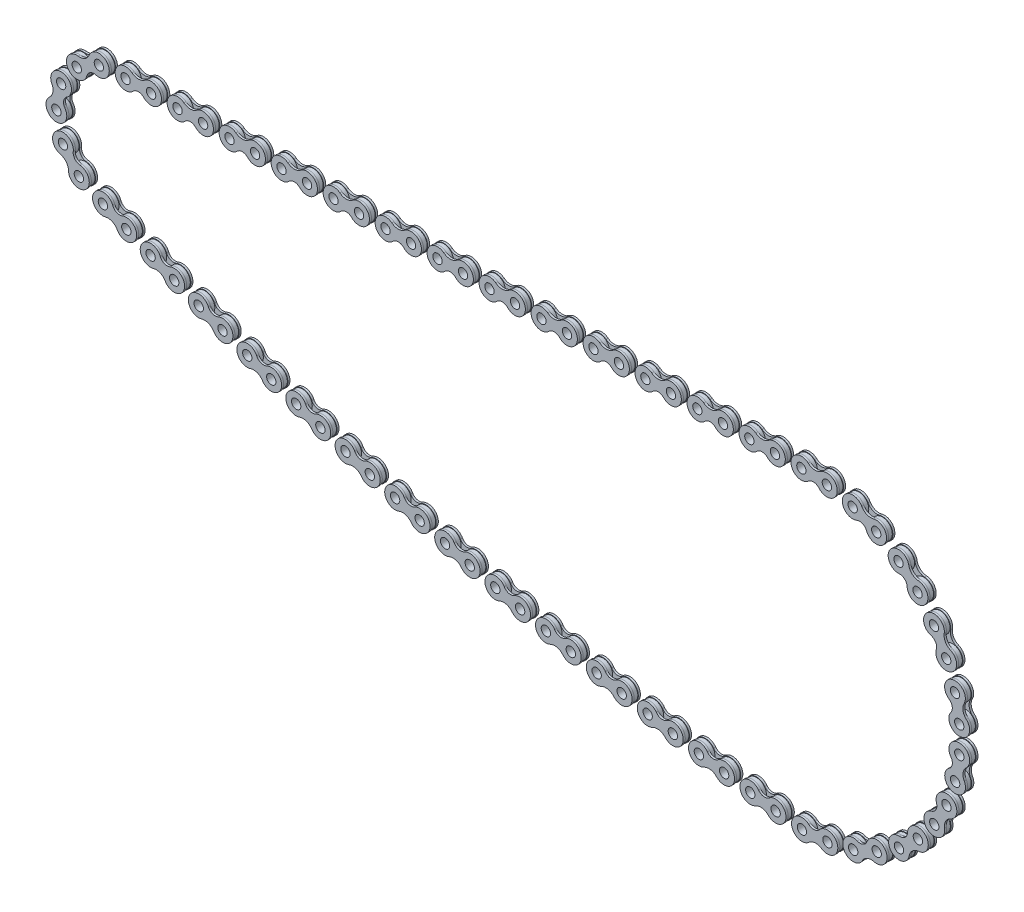
from build123d import *

# Parameters (mm, degrees)
SKETCH1_R             = 4.75
SKETCH1_R_2           = 2.25
BOSS_EXTRUDE1_DEPTH   = 1
BOSS_EXTRUDE1_2_DEPTH = 1
BOSS_EXTRUDE2_DEPTH   = 1
SKETCH4_R             = 2.25
CUT_EXTRUDE1_DEPTH    = 13.382346304
SKETCH5_R             = 2.25
CUT_EXTRUDE2_DEPTH    = 13.582626912
CRVPATTERN1_5_ANGLE   = 3.8901012
CRVPATTERN1_6_ANGLE   = 23.0027709
CRVPATTERN1_7_ANGLE   = 42.1154406
CRVPATTERN1_8_ANGLE   = 61.2281103
CRVPATTERN1_9_ANGLE   = 80.34078
CRVPATTERN1_10_ANGLE  = 99.4534497
CRVPATTERN1_11_ANGLE  = 118.5661194
CRVPATTERN1_12_ANGLE  = 137.6787891
CRVPATTERN1_13_ANGLE  = 156.7914588
CRVPATTERN1_14_ANGLE  = 175.9041285
CRVPATTERN1_15_ANGLE  = 172.3357403
CRVPATTERN1_16_ANGLE  = 171.095109
CRVPATTERN1_17_ANGLE  = 169.8544777
CRVPATTERN1_18_ANGLE  = 168.6138464
CRVPATTERN1_19_ANGLE  = 167.3732151
CRVPATTERN1_20_ANGLE  = 166.1325838
CRVPATTERN1_21_ANGLE  = 164.8919525
CRVPATTERN1_22_ANGLE  = 163.6513212
CRVPATTERN1_23_ANGLE  = 162.4106898
CRVPATTERN1_24_ANGLE  = 161.1700585
CRVPATTERN1_25_ANGLE  = 159.9294272
CRVPATTERN1_26_ANGLE  = 158.6887959
CRVPATTERN1_27_ANGLE  = 157.4481646
CRVPATTERN1_28_ANGLE  = 156.2075333
CRVPATTERN1_29_ANGLE  = 128.6116148
CRVPATTERN1_30_ANGLE  = 79.3521569
CRVPATTERN1_31_ANGLE  = 30.0926989


with BuildPart() as part:
    # Sketch1 → Boss-Extrude1 (new, symmetric)
    with BuildSketch(Plane.XY):
        with Locations((-6.15, 0)):
            Circle(SKETCH1_R)
        with Locations((-6.15, 0)):
            Circle(SKETCH1_R_2, mode=Mode.SUBTRACT)
    extrude(amount=BOSS_EXTRUDE1_DEPTH, both=True)



with BuildPart() as body_2:
    # Sketch1 → Boss-Extrude1 2 (new, symmetric)
    with BuildSketch(Plane.XY):
        with Locations(Location((6.15, 0, 0), (0, 0, 180))):
            Circle(SKETCH1_R)
        with Locations((6.15, 0)):
            Circle(SKETCH1_R_2, mode=Mode.SUBTRACT)
    extrude(amount=BOSS_EXTRUDE1_2_DEPTH, both=True)


with BuildPart() as part_1:
    add(part.part)

    add(body_2.part)  # Boss-Extrude2 merges body 2
    # Sketch2 → Boss-Extrude2 (add)
    with BuildSketch(Plane.XY.offset(1)):
        with BuildLine():
            ThreePointArc((-3.073778952, 3.941682897), (-11.138276168, -0.342200045), (-2.564324669, -3.484671063))
            ThreePointArc((-2.564324669, -3.484671063), (0, -2.400971337), (2.564324669, -3.484671063))
            ThreePointArc((2.564324669, -3.484671063), (11.138276168, -0.342200045), (3.073778952, 3.941682897))
            ThreePointArc((3.073778952, 3.941682897), (0, 2.884205953), (-3.073778952, 3.941682897))
        make_face()
    boss_extrude2 = extrude(amount=BOSS_EXTRUDE2_DEPTH)

    # Sketch4 → Cut-Extrude1 (cut, through all)
    with BuildSketch(Plane(origin=(0, 0, 1), x_dir=(-1, 0, 0), z_dir=(0, 0, -1))):
        with Locations((-6.15, 0)):
            Circle(SKETCH4_R)
        with Locations((6.15, 0)):
            Circle(SKETCH4_R)
    extrude(amount=-CUT_EXTRUDE1_DEPTH, mode=Mode.SUBTRACT)

    # Mirror1: Boss-Extrude2 across plane
    add(boss_extrude2.mirror(Plane.XY))

    # Sketch5 → Cut-Extrude2 (cut, through all)
    with BuildSketch(Plane.XY.offset(-1)):
        with Locations(Location((6.15, 0, 0), (0, 0, 180))):
            Circle(SKETCH5_R)
        with Locations(Location((-6.15, 0, 0), (0, 0, 180))):
            Circle(SKETCH5_R)
    extrude(amount=-CUT_EXTRUDE2_DEPTH, mode=Mode.SUBTRACT)


with BuildPart() as body_2_2:
    # CrvPattern1: read off the stored shape, not the designer's step
    # CrvPattern1: copy of part
    add(part_1.part.moved(Location((25.0184261, 0, 0))))


with BuildPart() as body_3:
    # CrvPattern1 2: copy of part
    add(part_1.part.moved(Location((50.0368522, 0, 0))))


with BuildPart() as body_4:
    # CrvPattern1 3: copy of part
    add(part_1.part.moved(Location((75.0552784, 0, 0))))


with BuildPart() as body_5:
    # CrvPattern1 4: copy of part
    add(part_1.part.moved(Location((100.0737045, 0, 0))))


with BuildPart() as body_6:
    # CrvPattern1 5: copy of part
    add(part_1.part.moved(Location((124.8094416, 8.3138717, 0))).rotate(Axis((0, 0, 0), (0, 0, -1)), CRVPATTERN1_5_ANGLE))


with BuildPart() as body_7:
    # CrvPattern1 6: copy of part
    add(part_1.part.moved(Location((139.7532434, 52.8539358, 0))).rotate(Axis((0, 0, 0), (0, 0, -1)), CRVPATTERN1_6_ANGLE))


with BuildPart() as body_8:
    # CrvPattern1 7: copy of part
    add(part_1.part.moved(Location((139.2896784, 99.831799, 0))).rotate(Axis((0, 0, 0), (0, 0, -1)), CRVPATTERN1_7_ANGLE))


with BuildPart() as body_9:
    # CrvPattern1 8: copy of part
    add(part_1.part.moved(Location((123.4698531, 144.0682958, 0))).rotate(Axis((0, 0, 0), (0, 0, -1)), CRVPATTERN1_8_ANGLE))


with BuildPart() as body_10:
    # CrvPattern1 9: copy of part
    add(part_1.part.moved(Location((94.0378548, 180.686488, 0))).rotate(Axis((0, 0, 0), (0, 0, -1)), CRVPATTERN1_9_ANGLE))


with BuildPart() as body_11:
    # CrvPattern1 10: copy of part
    add(part_1.part.moved(Location((54.2384712, 205.6493321, 0))).rotate(Axis((0, 0, 0), (0, 0, -1)), CRVPATTERN1_10_ANGLE))


with BuildPart() as body_12:
    # CrvPattern1 11: copy of part
    add(part_1.part.moved(Location((8.4594623, 216.204751, 0))).rotate(Axis((0, 0, 0), (0, 0, -1)), CRVPATTERN1_11_ANGLE))


with BuildPart() as body_13:
    # CrvPattern1 12: copy of part
    add(part_1.part.moved(Location((-38.2521764, 211.1890422, 0))).rotate(Axis((0, 0, 0), (0, 0, -1)), CRVPATTERN1_12_ANGLE))


with BuildPart() as body_14:
    # CrvPattern1 13: copy of part
    add(part_1.part.moved(Location((-80.7466298, 191.1551721, 0))).rotate(Axis((0, 0, 0), (0, 0, -1)), CRVPATTERN1_13_ANGLE))


with BuildPart() as body_15:
    # CrvPattern1 14: copy of part
    add(part_1.part.moved(Location((-114.3390147, 158.3118136, 0))).rotate(Axis((0, 0, 0), (0, 0, -1)), CRVPATTERN1_14_ANGLE))


with BuildPart() as body_16:
    # CrvPattern1 15: copy of part
    add(part_1.part.moved(Location((-119.3017468, 133.3012177, 0))).rotate(Axis((0, 0, 0), (0, 0, 1)), CRVPATTERN1_15_ANGLE))


with BuildPart() as body_17:
    # CrvPattern1 16: copy of part
    add(part_1.part.moved(Location((-97.144202, 130.9577631, 0))).rotate(Axis((0, 0, 0), (0, 0, 1)), CRVPATTERN1_16_ANGLE))


with BuildPart() as body_18:
    # CrvPattern1 17: copy of part
    add(part_1.part.moved(Location((-74.9411123, 129.0945999, 0))).rotate(Axis((0, 0, 0), (0, 0, 1)), CRVPATTERN1_17_ANGLE))


with BuildPart() as body_19:
    # CrvPattern1 18: copy of part
    add(part_1.part.moved(Location((-52.7028874, 127.7126017, 0))).rotate(Axis((0, 0, 0), (0, 0, 1)), CRVPATTERN1_18_ANGLE))


with BuildPart() as body_20:
    # CrvPattern1 19: copy of part
    add(part_1.part.moved(Location((-30.4399533, 126.8124164, 0))).rotate(Axis((0, 0, 0), (0, 0, 1)), CRVPATTERN1_19_ANGLE))


with BuildPart() as body_21:
    # CrvPattern1 20: copy of part
    add(part_1.part.moved(Location((-8.1627478, 126.394466, 0))).rotate(Axis((0, 0, 0), (0, 0, 1)), CRVPATTERN1_20_ANGLE))


with BuildPart() as body_22:
    # CrvPattern1 21: copy of part
    add(part_1.part.moved(Location((14.1182848, 126.4589464, 0))).rotate(Axis((0, 0, 0), (0, 0, 1)), CRVPATTERN1_21_ANGLE))


with BuildPart() as body_23:
    # CrvPattern1 22: copy of part
    add(part_1.part.moved(Location((36.3926981, 127.0058275, 0))).rotate(Axis((0, 0, 0), (0, 0, 1)), CRVPATTERN1_22_ANGLE))


with BuildPart() as body_24:
    # CrvPattern1 23: copy of part
    add(part_1.part.moved(Location((58.6500492, 128.0348528, 0))).rotate(Axis((0, 0, 0), (0, 0, 1)), CRVPATTERN1_23_ANGLE))


with BuildPart() as body_25:
    # CrvPattern1 24: copy of part
    add(part_1.part.moved(Location((80.8799028, 129.5455399, 0))).rotate(Axis((0, 0, 0), (0, 0, 1)), CRVPATTERN1_24_ANGLE))


with BuildPart() as body_26:
    # CrvPattern1 25: copy of part
    add(part_1.part.moved(Location((103.0718368, 131.5371805, 0))).rotate(Axis((0, 0, 0), (0, 0, 1)), CRVPATTERN1_25_ANGLE))


with BuildPart() as body_27:
    # CrvPattern1 26: copy of part
    add(part_1.part.moved(Location((125.2154468, 134.0088409, 0))).rotate(Axis((0, 0, 0), (0, 0, 1)), CRVPATTERN1_26_ANGLE))


with BuildPart() as body_28:
    # CrvPattern1 27: copy of part
    add(part_1.part.moved(Location((147.300351, 136.9593623, 0))).rotate(Axis((0, 0, 0), (0, 0, 1)), CRVPATTERN1_27_ANGLE))


with BuildPart() as body_29:
    # CrvPattern1 28: copy of part
    add(part_1.part.moved(Location((169.3161951, 140.3873613, 0))).rotate(Axis((0, 0, 0), (0, 0, 1)), CRVPATTERN1_28_ANGLE))


with BuildPart() as body_30:
    # CrvPattern1 29: copy of part
    add(part_1.part.moved(Location((108.2622836, 211.2050178, 0))).rotate(Axis((0, 0, 0), (0, 0, 1)), CRVPATTERN1_29_ANGLE))


with BuildPart() as body_31:
    # CrvPattern1 30: copy of part
    add(part_1.part.moved(Location((-67.3459635, 229.9636582, 0))).rotate(Axis((0, 0, 0), (0, 0, 1)), CRVPATTERN1_30_ANGLE))


with BuildPart() as body_32:
    # CrvPattern1 31: copy of part
    add(part_1.part.moved(Location((-196.1669077, 109.1526181, 0))).rotate(Axis((0, 0, 0), (0, 0, 1)), CRVPATTERN1_31_ANGLE))


with BuildPart() as body_33:
    # CrvPattern1 32: copy of part
    add(part_1.part.moved(Location((-200.147409, 0, 0))))


with BuildPart() as body_34:
    # CrvPattern1 33: copy of part
    add(part_1.part.moved(Location((-175.1289829, 0, 0))))


with BuildPart() as body_35:
    # CrvPattern1 34: copy of part
    add(part_1.part.moved(Location((-150.1105567, 0, 0))))


with BuildPart() as body_36:
    # CrvPattern1 35: copy of part
    add(part_1.part.moved(Location((-125.0921306, 0, 0))))


with BuildPart() as body_37:
    # CrvPattern1 36: copy of part
    add(part_1.part.moved(Location((-100.0737045, 0, 0))))


with BuildPart() as body_38:
    # CrvPattern1 37: copy of part
    add(part_1.part.moved(Location((-75.0552784, 0, 0))))


with BuildPart() as body_39:
    # CrvPattern1 38: copy of part
    add(part_1.part.moved(Location((-50.0368522, 0, 0))))


with BuildPart() as body_40:
    # CrvPattern1 39: copy of part
    add(part_1.part.moved(Location((-25.0184261, 0, 0))))


solid = Compound([part_1.part, body_2_2.part, body_3.part, body_4.part, body_5.part, body_6.part, body_7.part, body_8.part, body_9.part, body_10.part, body_11.part, body_12.part, body_13.part, body_14.part, body_15.part, body_16.part, body_17.part, body_18.part, body_19.part, body_20.part, body_21.part, body_22.part, body_23.part, body_24.part, body_25.part, body_26.part, body_27.part, body_28.part, body_29.part, body_30.part, body_31.part, body_32.part, body_33.part, body_34.part, body_35.part, body_36.part, body_37.part, body_38.part, body_39.part, body_40.part])
